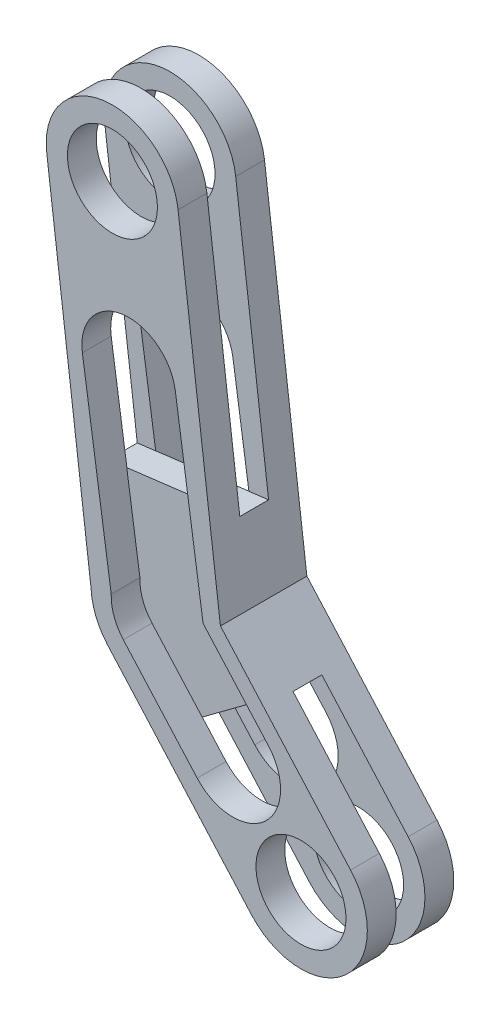
from build123d import *

# Parameters (mm, degrees)
SKETCH_1_R          = 12.5
EXTRUDE_1_DEPTH     = 8
EXTRUDE_START       = -8
SKETCH_2_R          = 12.5
EXTRUDE_2_DEPTH     = 8
CUT_EXTRUDE_6_DEPTH = 30
EXTRUDE_START_2     = -0.031547984
EXTRUDE_3_DEPTH     = 4.031547984
MIRROR_START        = -16
MIRROR_1_OUTLINE_R  = 12.5
MIRROR_1_DEPTH      = 8
MIRROR_START_2      = -8.031547984
MIRROR_1_2_DEPTH    = 4.031547984


# Read off the part's stored shape, not the designer's step: 镜向1
with BuildPart() as part:
    # 草图1 → 凸台-拉伸1 (new body)
    with BuildSketch(Plane.XY):
        with BuildLine():
            Line((-49.218570577, 33.143230451), (-9.339427202, -11.685933312))
            ThreePointArc((-9.339427202, -11.685933312), (-10.860056091, -37.708027961), (-36.882150741, -36.187399071))
            Line((-36.882150741, -36.187399071), (-76.761294116, 8.641764691))
            ThreePointArc((-76.761294116, 8.641764691), (-75.240665226, 34.663859341), (-49.218570577, 33.143230451))
        make_face()
        with Locations((-23.110788971, -23.936666192)):
            Circle(SKETCH_1_R, mode=Mode.SUBTRACT)
        with Locations((-62.989932346, 20.892497571)):
            Circle(SKETCH_1_R, mode=Mode.SUBTRACT)
    extrude(amount=EXTRUDE_1_DEPTH)

    # 草图2 → 凸台-拉伸2 (add)
    with BuildSketch(Plane.XY.offset(8).offset(EXTRUDE_START)):
        with BuildLine():
            Line((-81.224750465, 18.616304916), (-93.707423119, 118.616304916))
            ThreePointArc((-93.707423119, 118.616304916), (-77.748797655, 139.12731569), (-57.237786881, 123.168690226))
            Line((-57.237786881, 123.168690226), (-44.755114228, 23.168690226))
            ThreePointArc((-44.755114228, 23.168690226), (-60.713739692, 2.657679452), (-81.224750465, 18.616304916))
        make_face()
        with Locations((-62.989932346, 20.892497571)):
            Circle(SKETCH_2_R, mode=Mode.SUBTRACT)
        with Locations((-75.472605, 120.892497571)):
            Circle(SKETCH_2_R, mode=Mode.SUBTRACT)
    extrude(amount=EXTRUDE_2_DEPTH)

    # 草图4 → 切除-拉伸6 (cut)
    with BuildSketch(Plane.XY.offset(8)):
        with BuildLine():
            Line((-50.286228122, 27.138087208), (-32.136603064, 6.778447679))
            ThreePointArc((-32.136603064, 6.778447679), (-33.211064798, -11.943932547), (-51.933445024, -10.869470813))
            Line((-51.933445024, -10.869470813), (-72.45355192, 12.149295588))
            ThreePointArc((-72.45355192, 12.149295588), (-75.02839357, 16.472286713), (-75.807301146, 21.443339396))
            Line((-75.807301146, 21.443339396), (-83.815726922, 75.482800481))
            ThreePointArc((-83.815726922, 75.482800481), (-72.828124355, 90.29362358), (-58.017301256, 79.306021012))
            Line((-58.017301256, 79.306021012), (-50.286228122, 27.138087208))
        make_face()
    extrude(amount=-CUT_EXTRUDE_6_DEPTH, mode=Mode.SUBTRACT)

    # 草图5 → 凸台-拉伸3 (add)
    with BuildSketch(Plane(origin=(0, 0, 0), x_dir=(-1, 0, 0), z_dir=(0, 0, -1)).offset(EXTRUDE_START_2)):
        Polygon((48.100432454, 49.968385441), (84.570068691, 45.416000132), (81.591125202, 21.551371363), (80.712358407, 15.828262623), (79.125142105, 11.982622874), (76.761294116, 8.641764691), (63.001048061, -6.826479398), (33.316578165, 15.267394572), (45.474886231, 28.934859247), align=None)
    extrude(amount=EXTRUDE_3_DEPTH)



with BuildPart() as body_2:
    # 镜向1 outline → 镜向1 (new body)
    with BuildSketch(Plane.XY.offset(MIRROR_START)):
        with BuildLine():
            ThreePointArc((-81.401718429, 20.034013842), (-80.059923167, 13.939349041), (-76.761294116, 8.641764691))
            Line((-76.761294116, 8.641764691), (-36.882150741, -36.187399071))
            ThreePointArc((-36.882150741, -36.187399071), (-10.860056092, -37.708027961), (-9.339427202, -11.685933312))
            Line((-9.339427202, -11.685933312), (-45.474886231, 28.934859247))
            Line((-45.474886231, 28.934859247), (-57.237786881, 123.168690226))
            ThreePointArc((-57.237786881, 123.168690226), (-77.748797655, 139.12731569), (-93.707423119, 118.616304916))
            Line((-93.707423119, 118.616304916), (-81.401718429, 20.034013842))
        make_face()
        with BuildLine():
            Line((-75.807301146, 21.443339396), (-83.815726922, 75.482800481))
            ThreePointArc((-83.815726922, 75.482800481), (-72.828124355, 90.29362358), (-58.017301256, 79.306021012))
            Line((-58.017301256, 79.306021012), (-50.286228122, 27.138087208))
            Line((-50.286228122, 27.138087208), (-32.136603064, 6.778447679))
            ThreePointArc((-32.136603064, 6.778447679), (-33.211064798, -11.943932547), (-51.933445024, -10.869470813))
            Line((-51.933445024, -10.869470813), (-72.45355192, 12.149295588))
            ThreePointArc((-72.45355192, 12.149295588), (-75.02839357, 16.472286713), (-75.807301146, 21.443339396))
        make_face(mode=Mode.SUBTRACT)
        with Locations((-75.472605, 120.892497571)):
            Circle(MIRROR_1_OUTLINE_R, mode=Mode.SUBTRACT)
        with Locations((-23.110788971, -23.936666192)):
            Circle(MIRROR_1_OUTLINE_R, mode=Mode.SUBTRACT)
    extrude(amount=MIRROR_1_DEPTH)


with BuildPart() as part_1:
    add(part.part)

    add(body_2.part)  # Mirror 1 2 merges body 2
    # Mirror 1 2 outline → Mirror 1 2 (add)
    with BuildSketch(Plane.XY.offset(MIRROR_START_2)):
        Polygon((-81.591125202, 21.551371363), (-80.712358407, 15.828262623), (-79.125142105, 11.982622874), (-76.761294116, 8.641764691), (-63.001048061, -6.826479398), (-33.316578165, 15.267394572), (-45.474886231, 28.934859247), (-48.100432453, 49.968385441), (-84.570068691, 45.416000132), align=None)
    extrude(amount=MIRROR_1_2_DEPTH)


solid = part_1.part
